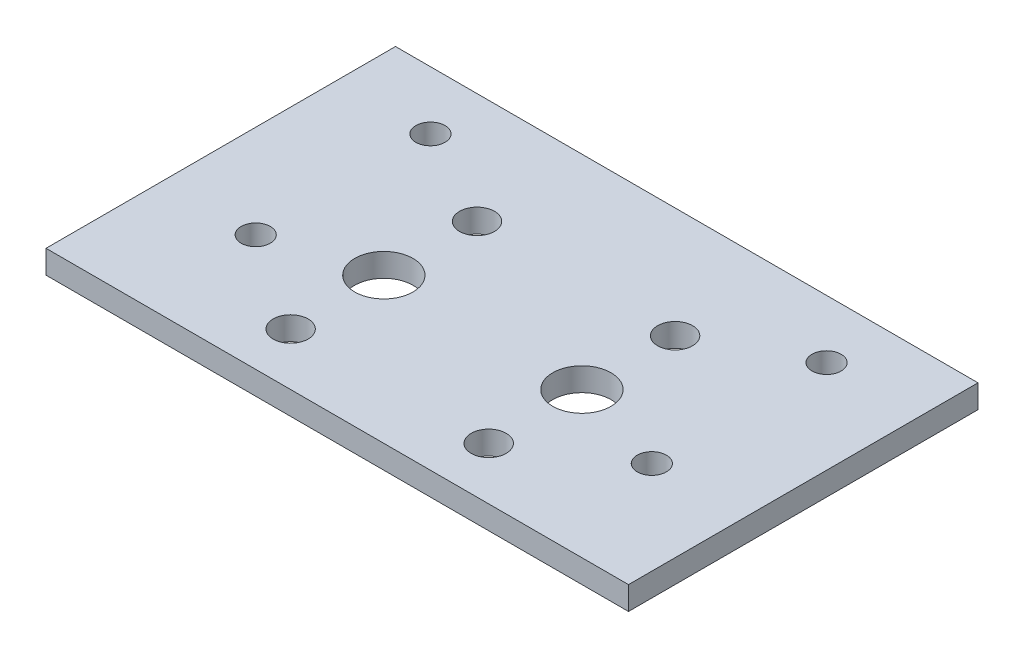
from build123d import *

# Parameters (mm, degrees)
SKETCH_1_W      = 100
SKETCH_1_H      = 60
SKETCH_1_R      = 2.5
SKETCH_1_R_2    = 5
SKETCH_1_R_3    = 3
EXTRUDE_1_DEPTH = 4


with BuildPart() as part:
    # Эскиз1 → Бобышка-Вытянуть1 (new body)
    with BuildSketch(Plane(origin=(0, 0, 0), x_dir=(1, 0, 0), z_dir=(0, 1, 0))):
        with Locations((50, 30)):
            Rectangle(SKETCH_1_W, SKETCH_1_H)
        with Locations((16, 50)):
            Circle(SKETCH_1_R, mode=Mode.SUBTRACT)
        with Locations((16, 20)):
            Circle(SKETCH_1_R, mode=Mode.SUBTRACT)
        with Locations((84, 50)):
            Circle(SKETCH_1_R, mode=Mode.SUBTRACT)
        with Locations((84, 20)):
            Circle(SKETCH_1_R, mode=Mode.SUBTRACT)
        with Locations((33, 25)):
            Circle(SKETCH_1_R_2, mode=Mode.SUBTRACT)
        with Locations((67, 25)):
            Circle(SKETCH_1_R_2, mode=Mode.SUBTRACT)
        with Locations((33, 41)):
            Circle(SKETCH_1_R_3, mode=Mode.SUBTRACT)
        with Locations((33, 9)):
            Circle(SKETCH_1_R_3, mode=Mode.SUBTRACT)
        with Locations((67, 41)):
            Circle(SKETCH_1_R_3, mode=Mode.SUBTRACT)
        with Locations((67, 9)):
            Circle(SKETCH_1_R_3, mode=Mode.SUBTRACT)
    extrude(amount=EXTRUDE_1_DEPTH)


solid = part.part
